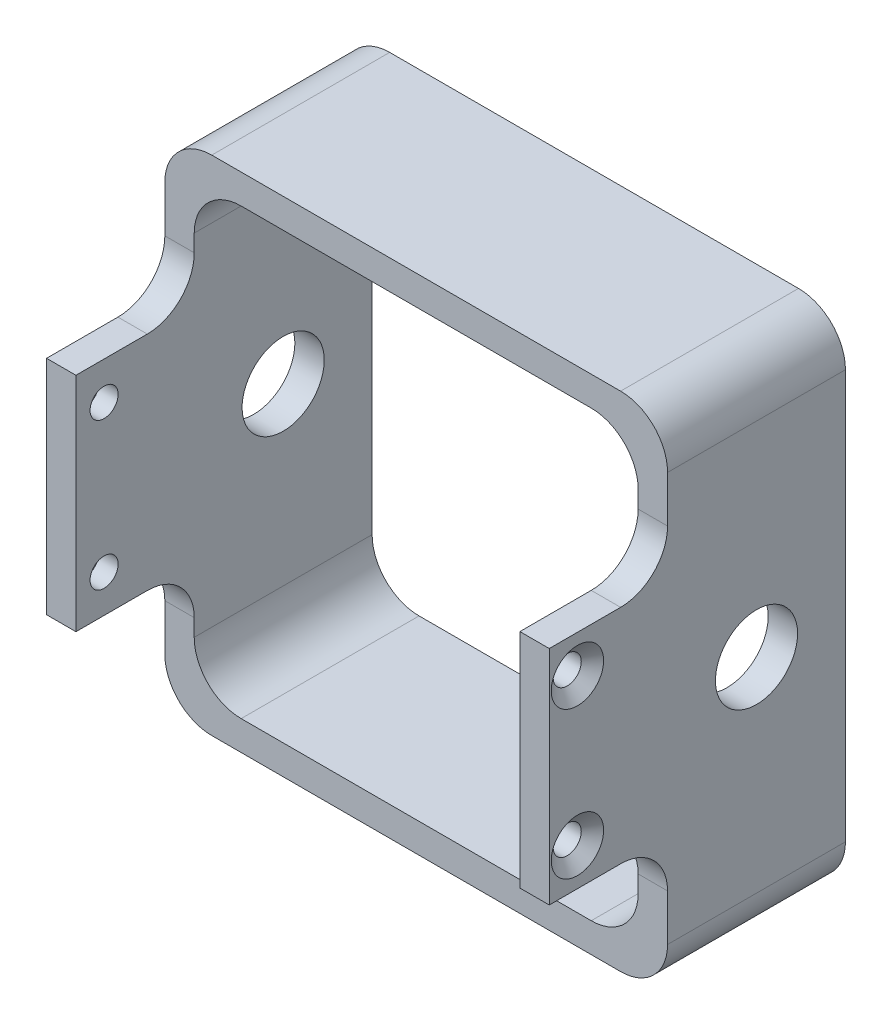
from build123d import *

# Parameters (mm, degrees)
SKETCH1_W                                 = 68.0085
SKETCH1_H                                 = 68.0085
SKETCH1_W_2                               = 60.0583
SKETCH1_H_2                               = 60.0583
BOSS_EXTRUDE1_DEPTH                       = 24.0665
F_7_16_0_4375_DIAMETER_HOLE1_D            = 11.1125
SKETCH10_W                                = 16.002
SKETCH10_H                                = 30.0482
BOSS_EXTRUDE2_DEPTH                       = 3.9751
FILLET1_R                                 = 6.35
FILLET1_OF_MIRROR1_R                      = 6.35
FILLET2_R                                 = 6.35
FILLET3_R                                 = 6.35
CSK_FOR_6_FLAT_HEAD_MACHINE_SCREW_2_COUNT = 2
CSK_FOR_6_FLAT_HEAD_MACHINE_SCREW_2_PITCH = 19.8882


with BuildPart() as part:
    # Sketch1 → Boss-Extrude1 (new body)
    with BuildSketch(Plane.XY):
        Rectangle(SKETCH1_W, SKETCH1_H)
        Rectangle(SKETCH1_W_2, SKETCH1_H_2, mode=Mode.SUBTRACT)
    extrude(amount=BOSS_EXTRUDE1_DEPTH)

    # 7/16 (0.4375) Diameter Hole1 (through all)
    with Locations(Plane(origin=(34.00425, 0, 0), x_dir=(0, 0, -1), z_dir=(1, 0, 0))):
        with Locations((-12.03325, 0)):
            Hole(F_7_16_0_4375_DIAMETER_HOLE1_D / 2)

    # Sketch10 → Boss-Extrude2 (add)
    with BuildSketch(Plane.ZY.offset(34.00425)):
        with Locations((32.0675, 0)):
            Rectangle(SKETCH10_W, SKETCH10_H)
    boss_extrude2 = extrude(amount=-BOSS_EXTRUDE2_DEPTH)

    # Fillet1
    fillet1_edges = [part.edges().sort_by_distance(p)[0] for p in [
        (-32.0167, -15.0241, 24.0665),
        (-32.0167, 15.0241, 24.0665),
    ]]
    fillet(fillet1_edges, radius=FILLET1_R)

    # Mirror1: Boss-Extrude2 across plane
    add(boss_extrude2.mirror(Plane(origin=(0, 0, 0), x_dir=(0, 0, 1), z_dir=(1, 0, 0))))

    # Fillet1 of Mirror1
    fillet1_of_mirror1_edges = [part.edges().sort_by_distance(p)[0] for p in [
        (32.0167, -15.0241, 24.0665),
        (32.0167, 15.0241, 24.0665),
    ]]
    fillet(fillet1_of_mirror1_edges, radius=FILLET1_OF_MIRROR1_R)

    # Fillet2
    fillet2_edges = [part.edges().sort_by_distance(p)[0] for p in [
        (-34.00425, -34.00425, 12.03325),
        (34.00425, -34.00425, 12.03325),
        (-34.00425, 34.00425, 12.03325),
        (34.00425, 34.00425, 12.03325),
    ]]
    fillet(fillet2_edges, radius=FILLET2_R)

    # Fillet3
    fillet3_edges = [part.edges().sort_by_distance(p)[0] for p in [
        (-30.02915, -30.02915, 12.03325),
        (30.02915, -30.02915, 12.03325),
        (-30.02915, 30.02915, 12.03325),
        (30.02915, 30.02915, 12.03325),
    ]]
    fillet(fillet3_edges, radius=FILLET3_R)

    # Sketch14 → CSK for #6 Flat Head Machine Screw (100)1 (revolve, cut)
    with BuildSketch(Plane(origin=(-34.00425, 9.9441, 36.2585), x_dir=(0, 0, 1), z_dir=(0, 1, 0))):
        Polygon((0, 0), (0, 10.538824014), (1.89865, 9.398), (1.89865, 1.380025208), (3.5433, 0), align=None)
    csk_for_6_flat_head_machine_screw_100 = revolve(axis=Axis((-40.35425, 9.9441, 36.2585), (1, 0, 0)), mode=Mode.SUBTRACT)

    # CSK for _6 Flat Head Machine Screw _ 2: CSK for #6 Flat Head Machine Screw (100)1 ×2
    with Locations(*[(0, -i * CSK_FOR_6_FLAT_HEAD_MACHINE_SCREW_2_PITCH, 0) for i in range(1, CSK_FOR_6_FLAT_HEAD_MACHINE_SCREW_2_COUNT)]):
        add(csk_for_6_flat_head_machine_screw_100, mode=Mode.SUBTRACT)

    # Mirror2: CSK for #6 Flat Head Machine Screw (100)1 across plane
    add(csk_for_6_flat_head_machine_screw_100.mirror(Plane(origin=(0, 0, 0), x_dir=(0, 0, 1), z_dir=(1, 0, 0))), mode=Mode.SUBTRACT)

    # Mirror2 copy 1 sketch → Mirror2 copy 1 (revolve, cut)
    with BuildSketch(Plane(origin=(34.00425, -9.9441, 36.2585), x_dir=(0, 0, 1), z_dir=(0, 1, 0))):
        Polygon((0, 0), (0, -10.538824014), (1.89865, -9.398), (1.89865, -1.380025208), (3.5433, 0), align=None)
    revolve(axis=Axis((40.35425, -9.9441, 36.2585), (1, 0, 0)), mode=Mode.SUBTRACT)


solid = part.part
